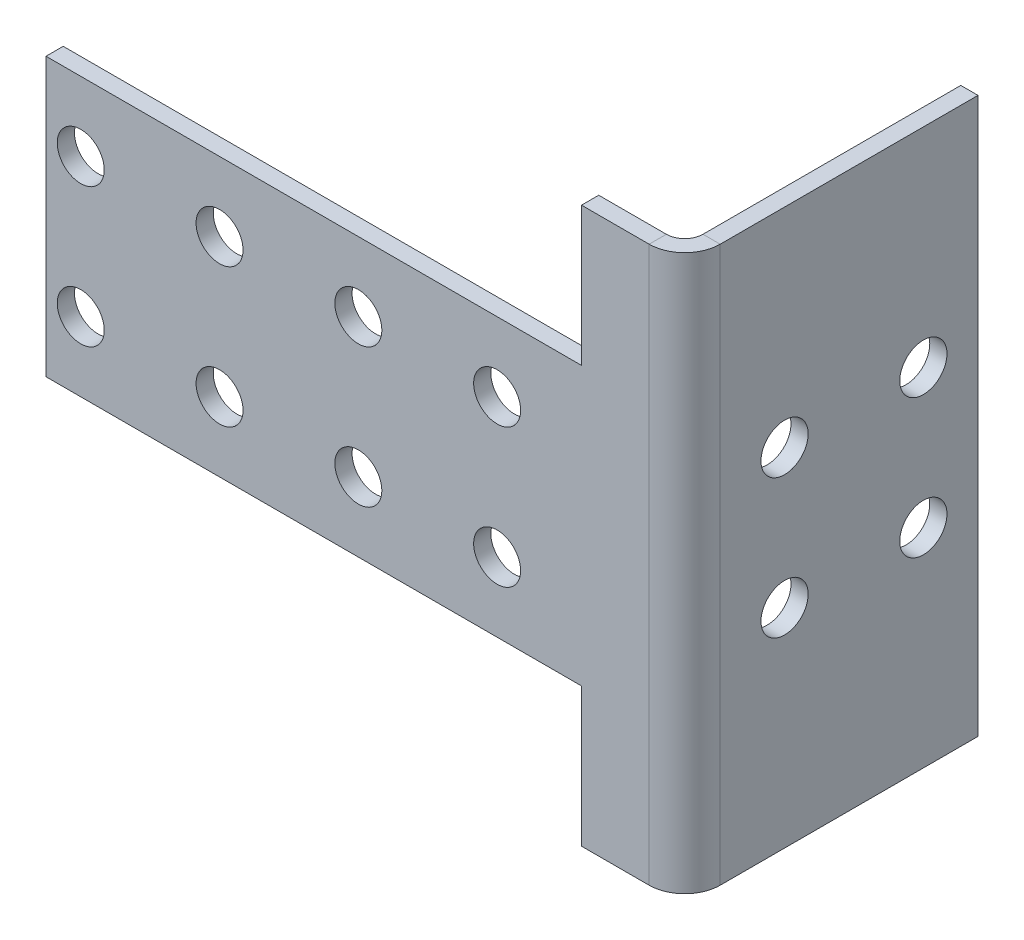
from build123d import *

# Parameters (mm, degrees)
SKETCH1_R                  = 2.15
SKETCH1_R_2                = 2.16
BASE_FLANGE1_DEPTH         = 1.5748
SKETCHED_START             = 58.096428764
SKETCHED_BEND1_OUTLINE_W   = 50.8
SKETCHED_BEND1_OUTLINE_H   = 1.5748
SKETCHED_BEND1_DEPTH       = 24.303571236
SKETCHED_START_2           = 56.865020508
SKETCHED_BEND1_2_OUTLINE_W = 50.8
SKETCHED_BEND1_2_OUTLINE_H = 25.265020508
SKETCHED_BEND1_2_OUTLINE_R = 2.16
SKETCHED_BEND1_2_DEPTH     = 0.589203492
SKETCHED_START_3           = 55.188620508
SKETCHED_BEND1_3_OUTLINE_W = 50.8
SKETCHED_BEND1_3_OUTLINE_H = 25.265020508
SKETCHED_BEND1_3_OUTLINE_R = 2.16
SKETCHED_BEND1_3_DEPTH     = 3.2512
SKETCHED_START_4           = -12.7
SKETCHED_BEND1_4_DEPTH     = 50.8


with BuildPart() as part:
    # Base-Flange1: sheet metal written as solids
    # Sketch1 → Base-Flange1 (new body)
    with BuildSketch(Plane.XY):
        Polygon((49, 25.4), (49, 38.1), (57, 38.1), (82.4, 38.1), (82.4, -12.7), (57, -12.7), (49, -12.7), (49, 0), (0, 0), (0, 25.4), align=None)
        with Locations((3.18, 19.05)):
            Circle(SKETCH1_R, mode=Mode.SUBTRACT)
        with Locations((15.88, 19.05)):
            Circle(SKETCH1_R, mode=Mode.SUBTRACT)
        with Locations((28.58, 19.05)):
            Circle(SKETCH1_R, mode=Mode.SUBTRACT)
        with Locations((15.88, 6.35)):
            Circle(SKETCH1_R, mode=Mode.SUBTRACT)
        with Locations((28.58, 6.35)):
            Circle(SKETCH1_R, mode=Mode.SUBTRACT)
        with Locations((3.18, 6.35)):
            Circle(SKETCH1_R, mode=Mode.SUBTRACT)
        with Locations((41.28, 19.05)):
            Circle(SKETCH1_R, mode=Mode.SUBTRACT)
        with Locations((41.28, 6.35)):
            Circle(SKETCH1_R, mode=Mode.SUBTRACT)
        with Locations((64.7, 19.05)):
            Circle(SKETCH1_R_2, mode=Mode.SUBTRACT)
        with Locations((77.4, 19.05)):
            Circle(SKETCH1_R_2, mode=Mode.SUBTRACT)
        with Locations((64.7, 6.35)):
            Circle(SKETCH1_R_2, mode=Mode.SUBTRACT)
        with Locations((77.4, 6.35)):
            Circle(SKETCH1_R_2, mode=Mode.SUBTRACT)
    extrude(amount=-BASE_FLANGE1_DEPTH)

    # Sketched Bend1: read off the stored shape, not the designer's step
    # Sketched Bend1 outline → Sketched Bend1 (cut)
    with BuildSketch(Plane.YZ.offset(SKETCHED_START)):
        with Locations((12.7, -0.7874)):
            Rectangle(SKETCHED_BEND1_OUTLINE_W, SKETCHED_BEND1_OUTLINE_H)
    extrude(amount=SKETCHED_BEND1_DEPTH, mode=Mode.SUBTRACT)

    # Sketched Bend1 2 outline → Sketched Bend1 2 (add)
    with BuildSketch(Plane.YZ.offset(SKETCHED_START_2)):
        with Locations((12.7, -14.207310254)):
            Rectangle(SKETCHED_BEND1_2_OUTLINE_W, SKETCHED_BEND1_2_OUTLINE_H)
        with Locations((6.35, -21.839820508)):
            Circle(SKETCHED_BEND1_2_OUTLINE_R, mode=Mode.SUBTRACT)
        with Locations((19.05, -21.839820508)):
            Circle(SKETCHED_BEND1_2_OUTLINE_R, mode=Mode.SUBTRACT)
        with Locations((6.35, -9.139820508)):
            Circle(SKETCHED_BEND1_2_OUTLINE_R, mode=Mode.SUBTRACT)
        with Locations((19.05, -9.139820508)):
            Circle(SKETCHED_BEND1_2_OUTLINE_R, mode=Mode.SUBTRACT)
    extrude(amount=SKETCHED_BEND1_2_DEPTH)

    # Sketched Bend1 3 outline → Sketched Bend1 3 (add)
    with BuildSketch(Plane.YZ.offset(SKETCHED_START_3)):
        with Locations((12.7, -14.207310254)):
            Rectangle(SKETCHED_BEND1_3_OUTLINE_W, SKETCHED_BEND1_3_OUTLINE_H)
        with Locations((6.35, -21.839820508)):
            Circle(SKETCHED_BEND1_3_OUTLINE_R, mode=Mode.SUBTRACT)
        with Locations((19.05, -21.839820508)):
            Circle(SKETCHED_BEND1_3_OUTLINE_R, mode=Mode.SUBTRACT)
        with Locations((6.35, -9.139820508)):
            Circle(SKETCHED_BEND1_3_OUTLINE_R, mode=Mode.SUBTRACT)
        with Locations((19.05, -9.139820508)):
            Circle(SKETCHED_BEND1_3_OUTLINE_R, mode=Mode.SUBTRACT)
    extrude(amount=SKETCHED_BEND1_3_DEPTH)

    # Sketched Bend1 4 outline → Sketched Bend1 4 (cut)
    with BuildSketch(Plane(origin=(0, 0, 0), x_dir=(1, 0, 0), z_dir=(0, 1, 0)).offset(SKETCHED_START_4)):
        with BuildLine():
            Line((56.865020508, 3.2512), (56.865020508, 26.839820508))
            Line((56.865020508, 26.839820508), (55.188620508, 26.839820508))
            Line((55.188620508, 26.839820508), (55.188620508, 1.5748))
            ThreePointArc((55.188620508, 1.5748), (56.374014316, 2.065806192), (56.865020508, 3.2512))
        make_face()
        with BuildLine():
            Line((58.439820508, 1.5748), (58.439820508, 3.2512))
            ThreePointArc((58.439820508, 3.2512), (57.487566075, 0.952254433), (55.188620508, 0))
            Line((55.188620508, 0), (58.096428764, 0))
            Line((58.096428764, 0), (58.096428764, 1.5748))
            Line((58.096428764, 1.5748), (58.439820508, 1.5748))
        make_face()
    extrude(amount=SKETCHED_BEND1_4_DEPTH, mode=Mode.SUBTRACT)


solid = part.part
